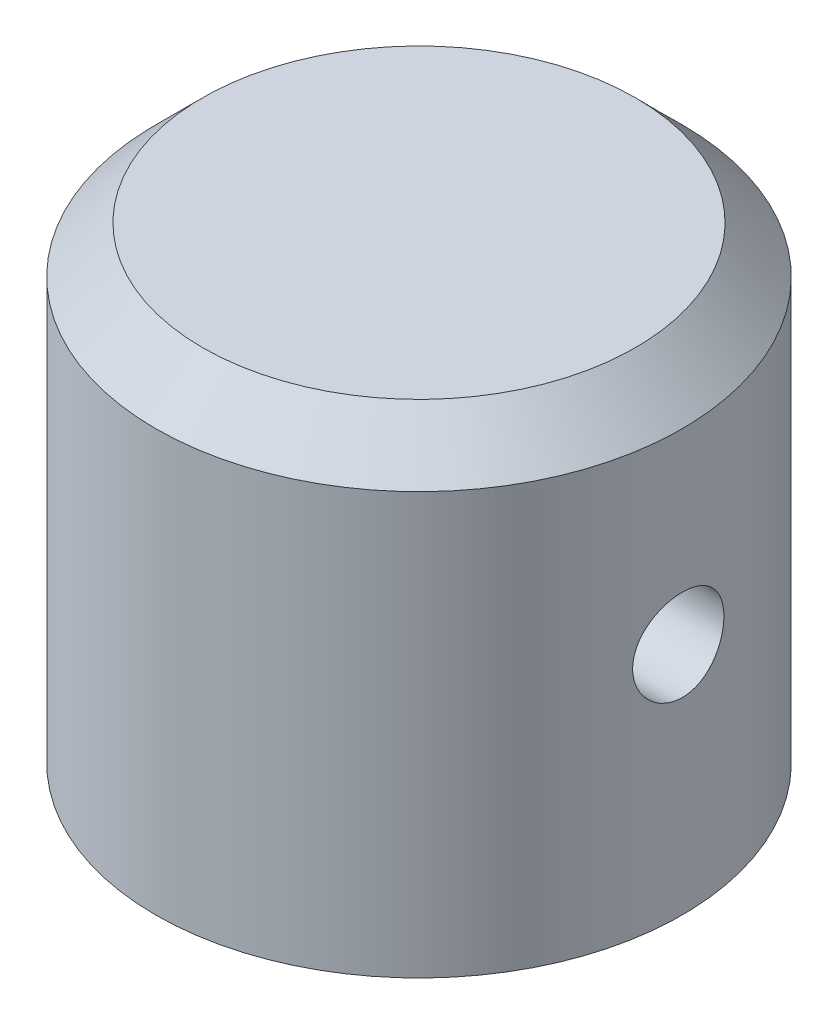
from build123d import *

# Parameters (mm, degrees)
SKETCH1_R               = 14.2875
BOSS_EXTRUDE1_DEPTH     = 25.4
SKETCH2_R               = 4
CUT_EXTRUDE1_DEPTH      = 8
CUT_EXTRUDE2_DEPTH      = 33.456514177
CUT_EXTRUDE2_DEPTH_BACK = 33.456514177
SKETCH3_R               = 2.4765
CHAMFER1_SIZE           = 2.54


with BuildPart() as part:
    # Sketch1 → Boss-Extrude1 (new body)
    with BuildSketch(Plane(origin=(0, 0, 0), x_dir=(1, 0, 0), z_dir=(0, 1, 0))):
        Circle(SKETCH1_R)
    extrude(amount=BOSS_EXTRUDE1_DEPTH)

    # Sketch2 → Cut-Extrude1 (cut)
    with BuildSketch(Plane(origin=(0, 0, 0), x_dir=(-1, 0, 0), z_dir=(0, -1, 0))):
        Circle(SKETCH2_R)
    extrude(amount=-CUT_EXTRUDE1_DEPTH, mode=Mode.SUBTRACT)

    # Sketch3 → Cut-Extrude2 (cut, two sides: drawn at the far end of the back side and taken through both)
    with BuildSketch(Plane(origin=(0, 0, 0), x_dir=(0, 0, -1), z_dir=(1, 0, 0)).offset(-CUT_EXTRUDE2_DEPTH_BACK)):
        with Locations((0, 12.7)):
            Circle(SKETCH3_R)
    extrude(amount=CUT_EXTRUDE2_DEPTH + CUT_EXTRUDE2_DEPTH_BACK, mode=Mode.SUBTRACT)

    # Chamfer1
    chamfer1_edges = [part.edges().sort_by_distance(p)[0] for p in [
        (-14.2875, 25.4, 0),
    ]]
    chamfer(chamfer1_edges, length=CHAMFER1_SIZE)


solid = part.part
